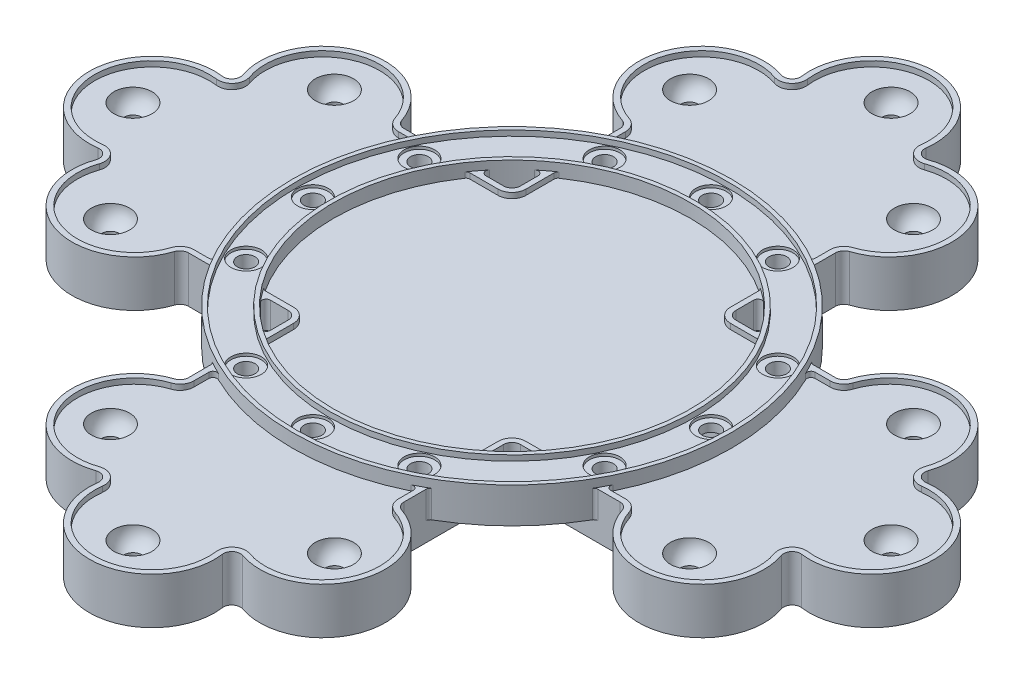
from build123d import *

# Parameters (mm, degrees)
BOSS_EXTRUDE1_DEPTH      = 17
CUT_EXTRUDE1_DEPTH       = 2
BOSS_EXTRUDE3_DEPTH      = 3
BOSS_EXTRUDE3_DEPTH_BACK = 10
SKETCH9_R                = 80.5
SKETCH9_R_2              = 65.5
SKETCH11_R               = 79
SKETCH11_R_2             = 67
CUT_EXTRUDE2_DEPTH       = 2
CUT_EXTRUDE3_DEPTH       = 14
SKETCH13_R               = 3.25
CUT_EXTRUDE4_DEPTH       = 220.920473223
SKETCH14_R               = 5.6
CUT_EXTRUDE5_DEPTH       = 1
SKETCH15_R               = 3.25
CUT_EXTRUDE6_DEPTH       = 220.840884603
CIRPATTERN1_COUNT        = 4
CUT_EXTRUDE7_DEPTH       = 5
FILLET1_R                = 1.55
FILLET2_R                = 1.5
FILLET3_R                = 1.5
FILLET4_R                = 1.5
FILLET5_R                = 1.5


with BuildPart() as part:
    # Sketch1 → Boss-Extrude1 (new body)
    with BuildSketch(Plane(origin=(0, 0, 0), x_dir=(1, 0, 0), z_dir=(0, 1, 0))):
        with BuildLine():
            Line((39.5, 42.6), (39.5, 79.145632842))
            ThreePointArc((39.5, 79.145632842), (40.088308339, 80.962609727), (41.629938711, 82.08994619))
            ThreePointArc((41.629938711, 82.08994619), (56.220648278, 111.302737172), (26.894618562, 125.66448998))
            ThreePointArc((26.894618562, 125.66448998), (23.920664875, 126.189846533), (22.804909736, 128.996176968))
            ThreePointArc((22.804909736, 128.996176968), (0, 154.98550665), (-22.804909736, 128.996176968))
            ThreePointArc((-22.804909736, 128.996176968), (-23.920664875, 126.189846533), (-26.894618562, 125.66448998))
            ThreePointArc((-26.894618562, 125.66448998), (-56.220648278, 111.302737172), (-41.629938711, 82.08994619))
            ThreePointArc((-41.629938711, 82.08994619), (-40.088308339, 80.962609727), (-39.5, 79.145632842))
            Line((-39.5, 79.145632842), (-39.5, 42.6))
            ThreePointArc((-39.5, 42.6), (-40.407968978, 40.407968978), (-42.6, 39.5))
            Line((-42.6, 39.5), (-79.145632842, 39.5))
            ThreePointArc((-79.145632842, 39.5), (-80.962609727, 40.088308339), (-82.08994619, 41.629938711))
            ThreePointArc((-82.08994619, 41.629938711), (-111.302737172, 56.220648278), (-125.66448998, 26.894618562))
            ThreePointArc((-125.66448998, 26.894618562), (-126.189846533, 23.920664875), (-128.996176968, 22.804909736))
            ThreePointArc((-128.996176968, 22.804909736), (-154.98550665, 0), (-128.996176968, -22.804909736))
            ThreePointArc((-128.996176968, -22.804909736), (-126.189846533, -23.920664875), (-125.66448998, -26.894618562))
            ThreePointArc((-125.66448998, -26.894618562), (-111.302737172, -56.220648278), (-82.08994619, -41.629938711))
            ThreePointArc((-82.08994619, -41.629938711), (-80.962609727, -40.088308339), (-79.145632842, -39.5))
            Line((-79.145632842, -39.5), (-42.6, -39.5))
            ThreePointArc((-42.6, -39.5), (-40.407968978, -40.407968978), (-39.5, -42.6))
            Line((-39.5, -42.6), (-39.5, -79.145632842))
            ThreePointArc((-39.5, -79.145632842), (-40.088308339, -80.962609727), (-41.629938711, -82.08994619))
            ThreePointArc((-41.629938711, -82.08994619), (-56.220648278, -111.302737172), (-26.894618562, -125.66448998))
            ThreePointArc((-26.894618562, -125.66448998), (-23.920664875, -126.189846533), (-22.804909736, -128.996176968))
            ThreePointArc((-22.804909736, -128.996176968), (0, -154.98550665), (22.804909736, -128.996176968))
            ThreePointArc((22.804909736, -128.996176968), (23.920664875, -126.189846533), (26.894618562, -125.66448998))
            ThreePointArc((26.894618562, -125.66448998), (56.220648278, -111.302737172), (41.629938711, -82.08994619))
            ThreePointArc((41.629938711, -82.08994619), (40.088308339, -80.962609727), (39.5, -79.145632842))
            Line((39.5, -79.145632842), (39.5, -42.6))
            ThreePointArc((39.5, -42.6), (40.407968978, -40.407968978), (42.6, -39.5))
            Line((42.6, -39.5), (79.145632842, -39.5))
            ThreePointArc((79.145632842, -39.5), (80.962609727, -40.088308339), (82.08994619, -41.629938711))
            ThreePointArc((82.08994619, -41.629938711), (111.302737172, -56.220648278), (125.66448998, -26.894618562))
            ThreePointArc((125.66448998, -26.894618562), (126.189846533, -23.920664875), (128.996176968, -22.804909736))
            ThreePointArc((128.996176968, -22.804909736), (154.98550665, 0), (128.996176968, 22.804909736))
            ThreePointArc((128.996176968, 22.804909736), (126.189846533, 23.920664875), (125.66448998, 26.894618562))
            ThreePointArc((125.66448998, 26.894618562), (111.302737172, 56.220648278), (82.08994619, 41.629938711))
            ThreePointArc((82.08994619, 41.629938711), (80.962609727, 40.088308339), (79.145632842, 39.5))
            Line((79.145632842, 39.5), (42.6, 39.5))
            ThreePointArc((42.6, 39.5), (40.407968978, 40.407968978), (39.5, 42.6))
        make_face()
    extrude(amount=BOSS_EXTRUDE1_DEPTH)

    # Sketch8 → Cut-Extrude1 (cut)
    with BuildSketch(Plane(origin=(0, 17, 0), x_dir=(1, 0, 0), z_dir=(0, 1, 0))):
        with BuildLine():
            Line((42.6, -37.5), (79.145632842, -37.5))
            ThreePointArc((79.145632842, -37.5), (82.134852879, -38.467862107), (83.98950319, -41.004092718))
            ThreePointArc((83.98950319, -41.004092718), (110.662051477, -54.326044931), (123.774956215, -27.550104756))
            ThreePointArc((123.774956215, -27.550104756), (124.63925248, -22.65747127), (129.25611868, -20.821874107))
            ThreePointArc((129.25611868, -20.821874107), (152.98550665, 0), (129.25611868, 20.821874107))
            ThreePointArc((129.25611868, 20.821874107), (124.63925248, 22.65747127), (123.774956215, 27.550104756))
            ThreePointArc((123.774956215, 27.550104756), (110.662051477, 54.326044931), (83.98950319, 41.004092718))
            ThreePointArc((83.98950319, 41.004092718), (82.134852879, 38.467862107), (79.145632842, 37.5))
            Line((79.145632842, 37.5), (42.6, 37.5))
            ThreePointArc((42.6, 37.5), (38.993755416, 38.993755416), (37.5, 42.6))
            Line((37.5, 42.6), (37.5, 79.145632842))
            ThreePointArc((37.5, 79.145632842), (38.467862107, 82.134852879), (41.004092718, 83.98950319))
            ThreePointArc((41.004092718, 83.98950319), (54.326044931, 110.662051477), (27.550104756, 123.774956215))
            ThreePointArc((27.550104756, 123.774956215), (22.65747127, 124.63925248), (20.821874107, 129.25611868))
            ThreePointArc((20.821874107, 129.25611868), (0, 152.98550665), (-20.821874107, 129.25611868))
            ThreePointArc((-20.821874107, 129.25611868), (-22.65747127, 124.63925248), (-27.550104756, 123.774956215))
            ThreePointArc((-27.550104756, 123.774956215), (-54.326044931, 110.662051477), (-41.004092718, 83.98950319))
            ThreePointArc((-41.004092718, 83.98950319), (-38.467862107, 82.134852879), (-37.5, 79.145632842))
            Line((-37.5, 79.145632842), (-37.5, 42.6))
            ThreePointArc((-37.5, 42.6), (-38.993755416, 38.993755416), (-42.6, 37.5))
            Line((-42.6, 37.5), (-79.145632842, 37.5))
            ThreePointArc((-79.145632842, 37.5), (-82.134852879, 38.467862107), (-83.98950319, 41.004092718))
            ThreePointArc((-83.98950319, 41.004092718), (-110.662051477, 54.326044931), (-123.774956215, 27.550104756))
            ThreePointArc((-123.774956215, 27.550104756), (-124.63925248, 22.65747127), (-129.25611868, 20.821874107))
            ThreePointArc((-129.25611868, 20.821874107), (-152.98550665, 0), (-129.25611868, -20.821874107))
            ThreePointArc((-129.25611868, -20.821874107), (-124.63925248, -22.65747127), (-123.774956215, -27.550104756))
            ThreePointArc((-123.774956215, -27.550104756), (-110.662051477, -54.326044931), (-83.98950319, -41.004092718))
            ThreePointArc((-83.98950319, -41.004092718), (-82.134852879, -38.467862107), (-79.145632842, -37.5))
            Line((-79.145632842, -37.5), (-42.6, -37.5))
            ThreePointArc((-42.6, -37.5), (-38.993755416, -38.993755416), (-37.5, -42.6))
            Line((-37.5, -42.6), (-37.5, -79.145632842))
            ThreePointArc((-37.5, -79.145632842), (-38.467862107, -82.134852879), (-41.004092718, -83.98950319))
            ThreePointArc((-41.004092718, -83.98950319), (-54.326044931, -110.662051477), (-27.550104756, -123.774956215))
            ThreePointArc((-27.550104756, -123.774956215), (-22.65747127, -124.63925248), (-20.821874107, -129.25611868))
            ThreePointArc((-20.821874107, -129.25611868), (0, -152.98550665), (20.821874107, -129.25611868))
            ThreePointArc((20.821874107, -129.25611868), (22.65747127, -124.63925248), (27.550104756, -123.774956215))
            ThreePointArc((27.550104756, -123.774956215), (54.326044931, -110.662051477), (41.004092718, -83.98950319))
            ThreePointArc((41.004092718, -83.98950319), (38.467862107, -82.134852879), (37.5, -79.145632842))
            Line((37.5, -79.145632842), (37.5, -42.6))
            ThreePointArc((37.5, -42.6), (38.993755416, -38.993755416), (42.6, -37.5))
        make_face()
    extrude(amount=-CUT_EXTRUDE1_DEPTH, mode=Mode.SUBTRACT)

    # Sketch9 → Boss-Extrude3 (add, two sides: drawn at the far end of the back side and taken through both)
    with BuildSketch(Plane(origin=(0, 17, 0), x_dir=(1, 0, 0), z_dir=(0, 1, 0)).offset(-BOSS_EXTRUDE3_DEPTH_BACK)):
        Circle(SKETCH9_R)
        Circle(SKETCH9_R_2, mode=Mode.SUBTRACT)
    extrude(amount=BOSS_EXTRUDE3_DEPTH + BOSS_EXTRUDE3_DEPTH_BACK)

    # Sketch11 → Cut-Extrude2 (cut)
    with BuildSketch(Plane(origin=(0, 20, 0), x_dir=(1, 0, 0), z_dir=(0, 1, 0))):
        Circle(SKETCH11_R)
        Circle(SKETCH11_R_2, mode=Mode.SUBTRACT)
    extrude(amount=-CUT_EXTRUDE2_DEPTH, mode=Mode.SUBTRACT)

    # Sketch12 → Cut-Extrude3 (cut)
    with BuildSketch(Plane(origin=(0, 0, 0), x_dir=(-1, 0, 0), z_dir=(0, -1, 0))):
        with BuildLine():
            Line((-49.044807789, 35.709979413), (-6.244807789, 35.709979413))
            ThreePointArc((-6.244807789, 35.709979413), (-4.052776767, 36.617948391), (-3.144807789, 38.809979413))
            Line((-3.144807789, 38.809979413), (-3.144807789, 61.809979413))
            Line((-3.144807789, 61.809979413), (18.855192211, 61.809979413))
            Line((18.855192211, 61.809979413), (18.855192211, 38.809979413))
            ThreePointArc((18.855192211, 38.809979413), (19.763161189, 36.617948391), (21.955192211, 35.709979413))
            Line((21.955192211, 35.709979413), (45.755192211, 35.709979413))
            ThreePointArc((45.755192211, 35.709979413), (47.947223233, 34.802010434), (48.855192211, 32.609979413))
            Line((48.855192211, 32.609979413), (48.855192211, 0.809979413))
            ThreePointArc((48.855192211, 0.809979413), (49.763161189, -1.382051609), (51.955192211, -2.290020587))
            Line((51.955192211, -2.290020587), (74.955192211, -2.290020587))
            Line((74.955192211, -2.290020587), (74.955192211, -25.290020587))
            Line((74.955192211, -25.290020587), (51.955192211, -25.290020587))
            ThreePointArc((51.955192211, -25.290020587), (49.763161189, -26.197989566), (48.855192211, -28.390020587))
            Line((48.855192211, -28.390020587), (48.855192211, -33.190020587))
            ThreePointArc((48.855192211, -33.190020587), (47.947223233, -35.382051609), (45.755192211, -36.290020587))
            Line((45.755192211, -36.290020587), (24.955192211, -36.290020587))
            ThreePointArc((24.955192211, -36.290020587), (22.763161189, -37.197989566), (21.855192211, -39.390020587))
            Line((21.855192211, -39.390020587), (21.855192211, -62.390020587))
            Line((21.855192211, -62.390020587), (-0.144807789, -62.390020587))
            Line((-0.144807789, -62.390020587), (-0.144807789, -39.390020587))
            ThreePointArc((-0.144807789, -39.390020587), (-1.052776767, -37.197989566), (-3.244807789, -36.290020587))
            Line((-3.244807789, -36.290020587), (-49.044807789, -36.290020587))
            ThreePointArc((-49.044807789, -36.290020587), (-51.236838811, -35.382051609), (-52.144807789, -33.190020587))
            Line((-52.144807789, -33.190020587), (-52.144807789, -11.390020587))
            ThreePointArc((-52.144807789, -11.390020587), (-53.052776767, -9.197989566), (-55.244807789, -8.290020587))
            Line((-55.244807789, -8.290020587), (-78.244807789, -8.290020587))
            Line((-78.244807789, -8.290020587), (-78.244807789, 13.709979413))
            Line((-78.244807789, 13.709979413), (-55.244807789, 13.709979413))
            ThreePointArc((-55.244807789, 13.709979413), (-53.052776767, 14.617948391), (-52.144807789, 16.809979413))
            Line((-52.144807789, 16.809979413), (-52.144807789, 32.609979413))
            ThreePointArc((-52.144807789, 32.609979413), (-51.236838811, 34.802010434), (-49.044807789, 35.709979413))
        make_face()
    extrude(amount=-CUT_EXTRUDE3_DEPTH, mode=Mode.SUBTRACT)

    # Sketch13 → Cut-Extrude4 (cut, through all)
    with BuildSketch(Plane(origin=(0, 18, 0), x_dir=(1, 0, 0), z_dir=(0, 1, 0))):
        with Locations((0, 73)):
            Circle(SKETCH13_R)
        with Locations((-31.766856868, 65.725693642)):
            Circle(SKETCH13_R)
        with Locations((31.766856868, 65.725693642)):
            Circle(SKETCH13_R)
        with Locations((65.725693642, 31.766856868)):
            Circle(SKETCH13_R)
        with Locations((73, 0)):
            Circle(SKETCH13_R)
        with Locations((65.725693642, -31.766856868)):
            Circle(SKETCH13_R)
        with Locations((31.766856868, -65.725693642)):
            Circle(SKETCH13_R)
        with Locations((0, -73)):
            Circle(SKETCH13_R)
        with Locations((-31.766856868, -65.725693642)):
            Circle(SKETCH13_R)
        with Locations((-65.725693642, -31.766856868)):
            Circle(SKETCH13_R)
        with Locations((-73, 0)):
            Circle(SKETCH13_R)
        with Locations((-65.725693642, 31.766856868)):
            Circle(SKETCH13_R)
    extrude(amount=-CUT_EXTRUDE4_DEPTH, mode=Mode.SUBTRACT)

    # Sketch14 → Cut-Extrude5 (cut)
    with BuildSketch(Plane(origin=(0, 18, 0), x_dir=(1, 0, 0), z_dir=(0, 1, 0))):
        with Locations((0, 73)):
            Circle(SKETCH14_R)
        with Locations((-31.766856868, 65.725693642)):
            Circle(SKETCH14_R)
        with Locations((31.766856868, 65.725693642)):
            Circle(SKETCH14_R)
        with Locations((65.725693642, 31.766856868)):
            Circle(SKETCH14_R)
        with Locations((73, 0)):
            Circle(SKETCH14_R)
        with Locations((65.725693642, -31.766856868)):
            Circle(SKETCH14_R)
        with Locations((31.766856868, -65.725693642)):
            Circle(SKETCH14_R)
        with Locations((0, -73)):
            Circle(SKETCH14_R)
        with Locations((-31.766856868, -65.725693642)):
            Circle(SKETCH14_R)
        with Locations((-65.725693642, -31.766856868)):
            Circle(SKETCH14_R)
        with Locations((-73, 0)):
            Circle(SKETCH14_R)
        with Locations((-65.725693642, 31.766856868)):
            Circle(SKETCH14_R)
    extrude(amount=-CUT_EXTRUDE5_DEPTH, mode=Mode.SUBTRACT)

    # Sketch15 → Cut-Extrude6 (cut, through all)
    with BuildSketch(Plane(origin=(0, 17, 0), x_dir=(1, 0, 0), z_dir=(0, 1, 0))):
        with Locations((-41.063821506, 106.177251613)):
            Circle(SKETCH15_R)
        with Locations((0, 138.98550665)):
            Circle(SKETCH15_R)
        with Locations((41.063821506, 106.177251613)):
            Circle(SKETCH15_R)
        with Locations((106.177251613, 41.063821506)):
            Circle(SKETCH15_R)
        with Locations((138.98550665, 0)):
            Circle(SKETCH15_R)
        with Locations((106.177251613, -41.063821506)):
            Circle(SKETCH15_R)
        with Locations((41.063821506, -106.177251613)):
            Circle(SKETCH15_R)
        with Locations((0, -138.98550665)):
            Circle(SKETCH15_R)
        with Locations((-41.063821506, -106.177251613)):
            Circle(SKETCH15_R)
        with Locations((-106.177251613, -41.063821506)):
            Circle(SKETCH15_R)
        with Locations((-138.98550665, 0)):
            Circle(SKETCH15_R)
        with Locations((-106.177251613, 41.063821506)):
            Circle(SKETCH15_R)
    extrude(amount=-CUT_EXTRUDE6_DEPTH, mode=Mode.SUBTRACT)

    # Sketch16 → Cut-Revolve1 (revolve, cut)
    with BuildSketch(Plane(origin=(0, 0, 0), x_dir=(0, 0, -1), z_dir=(1, 0, 0))):
        with BuildLine():
            Line((131.98550665, 15), (138.98550665, 15))
            Line((138.98550665, 15), (138.98550665, 8))
            ThreePointArc((138.98550665, 8), (134.035759181, 10.050252532), (131.98550665, 15))
        make_face()
    cut_revolve1 = revolve(axis=Axis((0, 15, -138.98550665), (0, -1, 0)), mode=Mode.SUBTRACT)

    # Sketch18 → Cut-Revolve3 (revolve, cut)
    with BuildSketch(Plane(origin=(41.063821506, 0, 0), x_dir=(0, 0, -1), z_dir=(1, 0, 0))):
        with BuildLine():
            Line((99.177251613, 15), (106.177251613, 15))
            Line((106.177251613, 15), (106.177251613, 8))
            ThreePointArc((106.177251613, 8), (101.227504145, 10.050252532), (99.177251613, 15))
        make_face()
    cut_revolve3 = revolve(axis=Axis((41.063821506, 15, -106.177251613), (0, -1, 0)), mode=Mode.SUBTRACT)

    # Mirror1: Cut-Revolve3 across plane
    add(cut_revolve3.mirror(Plane(origin=(0, 0, 0), x_dir=(0, 0, 1), z_dir=(1, 0, 0))), mode=Mode.SUBTRACT)

    # CirPattern1: Cut-Revolve1, Cut-Revolve3 ×4 about axis
    cirpattern1_axis = Axis((0, 0, 0), (0, 1, 0))
    add([cut_revolve1.rotate(cirpattern1_axis, i * 360 / CIRPATTERN1_COUNT) for i in range(1, CIRPATTERN1_COUNT)], mode=Mode.SUBTRACT)
    add([cut_revolve3.rotate(cirpattern1_axis, i * 360 / CIRPATTERN1_COUNT) for i in range(1, CIRPATTERN1_COUNT)], mode=Mode.SUBTRACT)

    # CirPattern1 copy 1 sketch → CirPattern1 copy 1 (revolve, cut)
    with BuildSketch(Plane(origin=(0, 0, 41.063821506), x_dir=(-1, 0, 0), z_dir=(0, 0, 1))):
        with BuildLine():
            Line((99.177251613, -15), (106.177251613, -15))
            Line((106.177251613, -15), (106.177251613, -8))
            ThreePointArc((106.177251613, -8), (101.227504145, -10.050252532), (99.177251613, -15))
        make_face()
    revolve(axis=Axis((-106.177251613, 15, 41.063821506), (0, 1, 0)), mode=Mode.SUBTRACT)

    # CirPattern1 copy 2 sketch → CirPattern1 copy 2 (revolve, cut)
    with BuildSketch(Plane(origin=(41.063821506, 0, 0), x_dir=(0, 0, 1), z_dir=(1, 0, 0))):
        with BuildLine():
            Line((99.177251613, -15), (106.177251613, -15))
            Line((106.177251613, -15), (106.177251613, -8))
            ThreePointArc((106.177251613, -8), (101.227504145, -10.050252532), (99.177251613, -15))
        make_face()
    revolve(axis=Axis((41.063821506, 15, 106.177251613), (0, 1, 0)), mode=Mode.SUBTRACT)

    # CirPattern1 copy 3 sketch → CirPattern1 copy 3 (revolve, cut)
    with BuildSketch(Plane(origin=(0, 0, -41.063821506), x_dir=(1, 0, 0), z_dir=(0, 0, -1))):
        with BuildLine():
            Line((99.177251613, -15), (106.177251613, -15))
            Line((106.177251613, -15), (106.177251613, -8))
            ThreePointArc((106.177251613, -8), (101.227504145, -10.050252532), (99.177251613, -15))
        make_face()
    revolve(axis=Axis((106.177251613, 15, -41.063821506), (0, 1, 0)), mode=Mode.SUBTRACT)

    # Sketch19 → Cut-Extrude7 (cut)
    with BuildSketch(Plane(origin=(0, 0, 0), x_dir=(-1, 0, 0), z_dir=(0, -1, 0))):
        with BuildLine():
            Line((-78.244807789, 13.709979413), (-87.01703532, 13.709979413))
            ThreePointArc((-87.01703532, 13.709979413), (-89.209066341, 14.617948391), (-90.11703532, 16.809979413))
            Line((-90.11703532, 16.809979413), (-90.11703532, 25.845350943))
            ThreePointArc((-90.11703532, 25.845350943), (-89.209066341, 28.037381965), (-87.01703532, 28.945350943))
            Line((-87.01703532, 28.945350943), (-65.920955231, 28.945350943))
            Line((-65.920955231, 28.945350943), (-65.920955231, 32.600596796))
            Line((-65.920955231, 32.600596796), (-101.26653346, 32.600596796))
            ThreePointArc((-101.26653346, 32.600596796), (-103.458564482, 33.508565774), (-104.36653346, 35.700596796))
            Line((-104.36653346, 35.700596796), (-104.36653346, 41.063821506))
            Line((-104.36653346, 41.063821506), (-107.815474924, 41.063821506))
            Line((-107.815474924, 41.063821506), (-107.815474924, 13.709979413))
            Line((-107.815474924, 13.709979413), (-107.815474924, 5.468392309))
            ThreePointArc((-107.815474924, 5.468392309), (-108.723443903, 3.276361288), (-110.915474924, 2.368392309))
            Line((-110.915474924, 2.368392309), (-137.935818213, 2.368392309))
            Line((-137.935818213, 2.368392309), (-137.935818213, -1.574143505))
            Line((-137.935818213, -1.574143505), (-110.915474924, -1.574143505))
            ThreePointArc((-110.915474924, -1.574143505), (-108.723443903, -2.482112483), (-107.815474924, -4.674143505))
            Line((-107.815474924, -4.674143505), (-107.815474924, -40.388642381))
            Line((-107.815474924, -40.388642381), (-104.36653346, -40.388642381))
            Line((-104.36653346, -40.388642381), (-104.36653346, -37.532709794))
            ThreePointArc((-104.36653346, -37.532709794), (-103.458564482, -35.340678772), (-101.26653346, -34.432709794))
            Line((-101.26653346, -34.432709794), (-65.920955231, -34.432709794))
            Line((-65.920955231, -34.432709794), (-65.920955231, -29.833805238))
            Line((-65.920955231, -29.833805238), (-87.01703532, -29.833805238))
            ThreePointArc((-87.01703532, -29.833805238), (-89.209066341, -28.925836259), (-90.11703532, -26.733805238))
            Line((-90.11703532, -26.733805238), (-90.11703532, -11.399969253))
            ThreePointArc((-90.11703532, -11.399969253), (-89.210308741, -9.209181335), (-87.020550352, -8.299971246))
            Line((-87.020550352, -8.299971246), (-78.244807789, -8.290020587))
            Line((-78.244807789, -8.290020587), (-78.244807789, 13.709979413))
        make_face()
        with BuildLine():
            Line((-3.144807789, 61.809979413), (-31.766856868, 62.475693642))
            Line((-31.766856868, 62.475693642), (-31.766856868, 68.975693642))
            Line((-31.766856868, 68.975693642), (-11.071563164, 68.975693642))
            ThreePointArc((-11.071563164, 68.975693642), (-8.879532142, 69.883662621), (-7.971563164, 72.075693642))
            Line((-7.971563164, 72.075693642), (-7.971563164, 99.676038445))
            ThreePointArc((-7.971563164, 99.676038445), (-8.87401477, 101.862538172), (-11.055938039, 102.775999067))
            Line((-11.055938039, 102.775999067), (-41.063821506, 102.927251613))
            Line((-41.063821506, 102.927251613), (-41.063821506, 109.427251613))
            Line((-41.063821506, 109.427251613), (-5.869877472, 109.427251613))
            ThreePointArc((-5.869877472, 109.427251613), (-3.677846451, 110.335220592), (-2.769877472, 112.527251613))
            Line((-2.769877472, 112.527251613), (-2.769877472, 138.98550665))
            Line((-2.769877472, 138.98550665), (3.25, 138.98550665))
            Line((3.25, 138.98550665), (3.25, 112.527251613))
            ThreePointArc((3.25, 112.527251613), (4.157968978, 110.335220592), (6.35, 109.427251613))
            Line((6.35, 109.427251613), (41.063821506, 109.427251613))
            Line((41.063821506, 109.427251613), (41.063821506, 102.927251613))
            Line((41.063821506, 102.927251613), (6.249282108, 102.927251613))
            ThreePointArc((6.249282108, 102.927251613), (4.057251086, 102.019282635), (3.149282108, 99.827251613))
            Line((3.149282108, 99.827251613), (3.149282108, 72.075693642))
            ThreePointArc((3.149282108, 72.075693642), (4.057251086, 69.883662621), (6.249282108, 68.975693642))
            Line((6.249282108, 68.975693642), (31.766856868, 68.975693642))
            Line((31.766856868, 68.975693642), (31.766856868, 62.475693642))
            Line((31.766856868, 62.475693642), (18.855192211, 61.809979413))
            Line((18.855192211, 61.809979413), (-3.144807789, 61.809979413))
        make_face()
        with BuildLine():
            Line((65.725693642, -29.833805238), (71.855192211, -29.833805238))
            ThreePointArc((71.855192211, -29.833805238), (74.047223233, -28.925836259), (74.955192211, -26.733805238))
            Line((74.955192211, -26.733805238), (74.955192211, -25.290020587))
            Line((74.955192211, -25.290020587), (74.473749469, 2.896646769))
            Line((74.473749469, 2.896646769), (83.885232098, 3.16433454))
            ThreePointArc((83.885232098, 3.16433454), (86.020069083, 4.102436057), (86.897095439, 6.263081372))
            Line((86.897095439, 6.263081372), (86.897095439, 25.845350943))
            ThreePointArc((86.897095439, 25.845350943), (85.989126461, 28.037381965), (83.797095439, 28.945350943))
            Line((83.797095439, 28.945350943), (65.725693642, 28.945350943))
            Line((65.725693642, 28.945350943), (65.725693642, 34.524582637))
            Line((65.725693642, 34.524582637), (99.827251613, 34.524582637))
            ThreePointArc((99.827251613, 34.524582637), (102.019282635, 35.432551615), (102.927251613, 37.624582637))
            Line((102.927251613, 37.624582637), (102.927251613, 41.063821506))
            Line((102.927251613, 41.063821506), (109.427251613, 41.063821506))
            Line((109.427251613, 41.063821506), (109.427251613, 6.35))
            ThreePointArc((109.427251613, 6.35), (110.335220592, 4.157968978), (112.527251613, 3.25))
            Line((112.527251613, 3.25), (138.98550665, 3.25))
            Line((138.98550665, 3.25), (139.151785326, -2.596097729))
            Line((139.151785326, -2.596097729), (112.527251613, -2.596097729))
            ThreePointArc((112.527251613, -2.596097729), (110.335220592, -3.504066707), (109.427251613, -5.696097729))
            Line((109.427251613, -5.696097729), (109.427251613, -41.063821506))
            Line((109.427251613, -41.063821506), (103.934851681, -41.063821506))
            Line((103.934851681, -41.063821506), (103.934851681, -38.116856868))
            ThreePointArc((103.934851681, -38.116856868), (103.026882703, -35.924825846), (100.834851681, -35.016856868))
            Line((100.834851681, -35.016856868), (65.725693642, -35.016856868))
            Line((65.725693642, -35.016856868), (65.725693642, -29.833805238))
        make_face()
        with BuildLine():
            Line((-31.766856868, -62.475693642), (-0.144807789, -62.475693642))
            Line((-0.144807789, -62.475693642), (-0.144807789, -62.390020587))
            Line((-0.144807789, -62.390020587), (21.855192211, -62.390020587))
            Line((21.855192211, -62.390020587), (21.855192211, -62.475693642))
            Line((21.855192211, -62.475693642), (31.766856868, -62.475693642))
            Line((31.766856868, -62.475693642), (31.766856868, -68.975693642))
            Line((31.766856868, -68.975693642), (24.955192211, -68.975693642))
            ThreePointArc((24.955192211, -68.975693642), (22.763161189, -69.883662621), (21.855192211, -72.075693642))
            Line((21.855192211, -72.075693642), (21.855192211, -99.827251613))
            ThreePointArc((21.855192211, -99.827251613), (22.763161189, -102.019282635), (24.955192211, -102.927251613))
            Line((24.955192211, -102.927251613), (41.063821506, -102.927251613))
            Line((41.063821506, -102.927251613), (41.063821506, -109.427251613))
            Line((41.063821506, -109.427251613), (6.35, -109.427251613))
            ThreePointArc((6.35, -109.427251613), (4.157968978, -110.335220592), (3.25, -112.527251613))
            Line((3.25, -112.527251613), (3.25, -138.98550665))
            Line((3.25, -138.98550665), (-3.25, -138.98550665))
            Line((-3.25, -138.98550665), (-3.25, -112.527251613))
            ThreePointArc((-3.25, -112.527251613), (-4.157968978, -110.335220592), (-6.35, -109.427251613))
            Line((-6.35, -109.427251613), (-41.063821506, -109.427251613))
            Line((-41.063821506, -109.427251613), (-41.063821506, -102.927251613))
            Line((-41.063821506, -102.927251613), (-6.35, -102.927251613))
            ThreePointArc((-6.35, -102.927251613), (-4.157968978, -102.019282635), (-3.25, -99.827251613))
            Line((-3.25, -99.827251613), (-3.25, -72.075693642))
            ThreePointArc((-3.25, -72.075693642), (-4.157968978, -69.883662621), (-6.35, -68.975693642))
            Line((-6.35, -68.975693642), (-31.766856868, -68.975693642))
            Line((-31.766856868, -68.975693642), (-31.766856868, -62.475693642))
        make_face()
    extrude(amount=-CUT_EXTRUDE7_DEPTH, mode=Mode.SUBTRACT)

    # Fillet1
    fillet1_edges = [part.edges().sort_by_distance(p)[0] for p in [
        (37.5, 16, -71.232015274),
    ]]
    fillet(fillet1_edges, radius=FILLET1_R)

    # Fillet2
    fillet2_edges = [part.edges().sort_by_distance(p)[0] for p in [
        (-37.5, 16, 71.232015274),
        (37.5, 16, 71.232015274),
        (-71.232015274, 16, 37.5),
        (-71.232015274, 16, -37.5),
        (-37.5, 16, -71.232015274),
        (71.232015274, 16, 37.5),
        (71.232015274, 16, -37.5),
    ]]
    fillet(fillet2_edges, radius=FILLET2_R)

    # Fillet3
    fillet3_edges = [part.edges().sort_by_distance(p)[0] for p in [
        (53.702886328, 16, -37.5),
        (37.5, 16, -53.702886328),
        (-37.5, 16, -53.702886328),
        (-53.702886328, 16, -37.5),
        (-53.702886328, 16, 37.5),
        (-37.5, 16, 53.702886328),
        (53.702886328, 16, 37.5),
        (37.5, 16, 53.702886328),
    ]]
    fillet(fillet3_edges, radius=FILLET3_R)

    # Fillet4
    fillet4_edges = [part.edges().sort_by_distance(p)[0] for p in [
        (39.5, 12, 52.24940191),
        (52.24940191, 12, 39.5),
        (52.24940191, 12, -39.5),
        (39.5, 12, -52.24940191),
        (-39.5, 12, -52.24940191),
        (-52.24940191, 12, -39.5),
        (-39.5, 12, 52.24940191),
        (-52.24940191, 12, 39.5),
    ]]
    fillet(fillet4_edges, radius=FILLET4_R)

    # Fillet5
    fillet5_edges = [part.edges().sort_by_distance(p)[0] for p in [
        (39.5, 12, -70.142711667),
        (70.142711667, 12, -39.5),
        (70.142711667, 12, 39.5),
        (39.5, 12, 70.142711667),
        (-39.5, 12, 70.142711667),
        (-70.142711667, 12, 39.5),
        (-39.5, 12, -70.142711667),
        (-70.142711667, 12, -39.5),
    ]]
    fillet(fillet5_edges, radius=FILLET5_R)


solid = part.part
